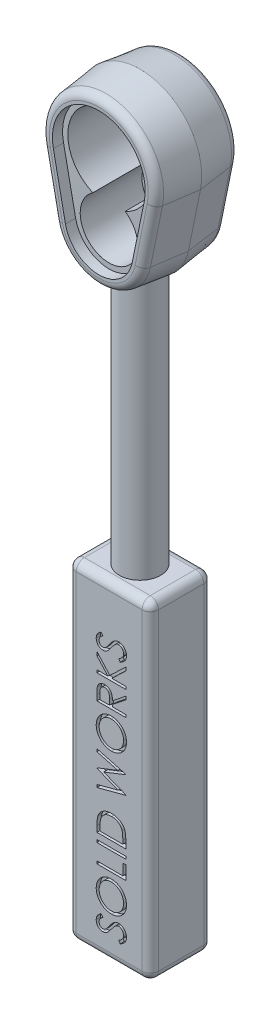
from build123d import *

# Parameters (mm, degrees)
BOSS_EXTRUDE1_DEPTH           = 0.5
BOSS_EXTRUDE1_TAPER           = 7
BOSS_EXTRUDE1_OTHER_WAY_DEPTH = 0.5
BOSS_EXTRUDE1_OTHER_WAY_TAPER = 7
CUT_EXTRUDE1_DEPTH            = 0.1235
CUT_EXTRUDE2_DEPTH            = 0.75
SKETCH6_R                     = 0.175
CUT_EXTRUDE3_DEPTH            = 2.890899971
FILLET3_R                     = 0.1
FILLET4_R                     = 0.1
BOSS_EXTRUDE2_REACH           = 7.573
SKETCH7_R                     = 0.25
SKETCH8_W                     = 1
SKETCH8_H                     = 4
BOSS_EXTRUDE3_DEPTH           = 0.375
FILLET5_R                     = 0.1
FILLET6_R                     = 0.1
SKETCH9_W                     = 0.35
SKETCH9_H                     = 0.031410256
CUT_EXTRUDE6_DEPTH            = 0.05


with BuildPart() as part:
    # Sketch2 → Boss-Extrude1 (new body)
    with BuildSketch(Plane.XY):
        with BuildLine():
            Line((-0.734846923, 0.6), (-0.587877538, -0.12))
            ThreePointArc((-0.587877538, -0.12), (0, -0.6), (0.587877538, -0.12))
            Line((0.587877538, -0.12), (0.734846923, 0.6))
            ThreePointArc((0.734846923, 0.6), (0, 1.5), (-0.734846923, 0.6))
        make_face()
    extrude(amount=BOSS_EXTRUDE1_DEPTH, taper=BOSS_EXTRUDE1_TAPER)

    # Sketch2 → Boss-Extrude1 other way (add)
    with BuildSketch(Plane.XY):
        with BuildLine():
            Line((-0.734846923, 0.6), (-0.587877538, -0.12))
            ThreePointArc((-0.587877538, -0.12), (0, -0.6), (0.587877538, -0.12))
            Line((0.587877538, -0.12), (0.734846923, 0.6))
            ThreePointArc((0.734846923, 0.6), (0, 1.5), (-0.734846923, 0.6))
        make_face()
    extrude(amount=-BOSS_EXTRUDE1_OTHER_WAY_DEPTH, taper=BOSS_EXTRUDE1_OTHER_WAY_TAPER)

    # Sketch4 → Cut-Extrude1 (cut)
    with BuildSketch(Plane.XY.offset(0.5)):
        with BuildLine():
            Line((-0.552220531, 0.637278456), (-0.405251147, -0.082721544))
            ThreePointArc((-0.405251147, -0.082721544), (0, -0.41360772), (0.405251147, -0.082721544))
            Line((0.405251147, -0.082721544), (0.552220531, 0.637278456))
            ThreePointArc((0.552220531, 0.637278456), (0, 1.31360772), (-0.552220531, 0.637278456))
        make_face()
    extrude(amount=-CUT_EXTRUDE1_DEPTH, mode=Mode.SUBTRACT)

    # Sketch5 → Cut-Extrude2 (cut)
    with BuildSketch(Plane.XY.offset(0.3765)):
        with BuildLine():
            ThreePointArc((-0.195959179, 0.29), (0, -0.35), (0.195959179, 0.29))
            ThreePointArc((0.195959179, 0.29), (0, 1.25), (-0.195959179, 0.29))
        make_face()
    extrude(amount=-CUT_EXTRUDE2_DEPTH, mode=Mode.SUBTRACT)

    # Sketch6 → Cut-Extrude3 (cut, through all)
    with BuildSketch(Plane.XY.offset(-0.3735)):
        Circle(SKETCH6_R)
        with Locations((0, 0.75)):
            Circle(SKETCH6_R)
    extrude(amount=-CUT_EXTRUDE3_DEPTH, mode=Mode.SUBTRACT)

    # Fillet3
    fillet3_edges = [part.edges().sort_by_distance(p)[0] for p in [
        (0, 1.43860772, 0.5),
        (-0.601210326, 0.252278456, 0.5),
        (0, -0.53860772, 0.5),
        (0.601210326, 0.252278456, 0.5),
    ]]
    fillet(fillet3_edges, radius=FILLET3_R)

    # Fillet4
    fillet4_edges = [part.edges().sort_by_distance(p)[0] for p in [
        (0, -0.53860772, -0.5),
        (0.601210326, 0.252278456, -0.5),
        (0, 1.43860772, -0.5),
        (-0.601210326, 0.252278456, -0.5),
    ]]
    fillet(fillet4_edges, radius=FILLET4_R)

    # Sketch7 → Boss-Extrude2 (add, up to next)
    with BuildSketch(Plane(origin=(0, -4, 0), x_dir=(1, 0, 0), z_dir=(0, 1, 0)), mode=Mode.PRIVATE) as boss_extrude2_sk1:
        with Locations(Location((0, 0, 0), (0, 0, 179.999989414))):
            Circle(SKETCH7_R)
    boss_extrude2_tool1 = extrude(boss_extrude2_sk1.sketch, amount=BOSS_EXTRUDE2_REACH, mode=Mode.PRIVATE) - part.part
    add(boss_extrude2_tool1.solids().sort_by_distance((0, -4, 0))[0])

    # Sketch8 → Boss-Extrude3 (add, symmetric)
    with BuildSketch(Plane.XY):
        with Locations((0, -5.7)):
            Rectangle(SKETCH8_W, SKETCH8_H)
    extrude(amount=BOSS_EXTRUDE3_DEPTH, both=True)

    # Fillet5
    fillet5_edges = [part.edges().sort_by_distance(p)[0] for p in [
        (-0.5, -5.7, -0.375),
        (0.5, -5.7, -0.375),
        (0.5, -7.7, 0),
        (0.5, -3.7, 0),
        (-0.5, -5.7, 0.375),
        (0.5, -5.7, 0.375),
    ]]
    fillet(fillet5_edges, radius=FILLET5_R)

    # Fillet6
    # the kernel refuses this fillet: 0.1 mm, written as the material it takes off along each edge
    with BuildSketch(Plane(origin=(0.4, -3.8, 0.275), x_dir=(0, 0, 1), z_dir=(0, 1, 0))) as fillet6_piece_1_section:
        Polygon((0, 0), (FILLET6_R, 0), (FILLET6_R, FILLET6_R), (0, FILLET6_R), align=None)
    fillet6_piece_1 = extrude(amount=FILLET6_R, mode=Mode.PRIVATE)
    fillet6_piece_1 = fillet6_piece_1 - Plane(origin=(0.4, -3.8, 0.275), x_dir=(-0.7071067811865475, 0, -0.7071067811865475), z_dir=(0, 1, 0)) * Sphere(FILLET6_R, mode=Mode.PRIVATE)
    add(fillet6_piece_1, mode=Mode.SUBTRACT)
    with BuildSketch(Plane(origin=(0.4, -3.8, -0.275), x_dir=(0, 0, -1), z_dir=(0, 1, 0))) as fillet6_piece_2_section:
        Polygon((0, 0), (FILLET6_R, 0), (FILLET6_R, -FILLET6_R), (0, -FILLET6_R), align=None)
    fillet6_piece_2 = extrude(amount=FILLET6_R, mode=Mode.PRIVATE)
    fillet6_piece_2 = fillet6_piece_2 - Plane(origin=(0.4, -3.8, -0.275), x_dir=(-0.7071067811865475, 0, 0.7071067811865475), z_dir=(0, 1, 0)) * Sphere(FILLET6_R, mode=Mode.PRIVATE)
    add(fillet6_piece_2, mode=Mode.SUBTRACT)
    with BuildSketch(Plane(origin=(0.4, -7.6, 0.275), x_dir=(0, -1, 0), z_dir=(0, 0, 1))) as fillet6_piece_3_section:
        Polygon((0, 0), (FILLET6_R, 0), (FILLET6_R, FILLET6_R), (0, FILLET6_R), align=None)
    fillet6_piece_3 = extrude(amount=FILLET6_R, mode=Mode.PRIVATE)
    fillet6_piece_3 = fillet6_piece_3 - Plane(origin=(0.4, -7.6, 0.275), x_dir=(-0.7071067811865476, 0.7071067811865475, 0), z_dir=(0, 0, 1)) * Sphere(FILLET6_R, mode=Mode.PRIVATE)
    add(fillet6_piece_3, mode=Mode.SUBTRACT)
    with BuildSketch(Plane(origin=(0.4, -7.6, -0.275), x_dir=(0, -1, 0), z_dir=(0, 0, -1))) as fillet6_piece_4_section:
        Polygon((0, 0), (FILLET6_R, 0), (FILLET6_R, -FILLET6_R), (0, -FILLET6_R), align=None)
    fillet6_piece_4 = extrude(amount=FILLET6_R, mode=Mode.PRIVATE)
    fillet6_piece_4 = fillet6_piece_4 - Plane(origin=(0.4, -7.6, -0.275), x_dir=(-0.7071067811865476, 0.7071067811865475, 0), z_dir=(0, 0, -1)) * Sphere(FILLET6_R, mode=Mode.PRIVATE)
    add(fillet6_piece_4, mode=Mode.SUBTRACT)
    with BuildSketch(Plane(origin=(0.4, -7.7, -0.375), x_dir=(0, 1, 0), z_dir=(-1, 0, 0)), Plane(origin=(-0.4, -3.7, 0.375), x_dir=(0, 0, -1), z_dir=(1, 0, 0))) as fillet6_piece_5:
        with BuildLine():
            CenterArc((FILLET6_R, -FILLET6_R), FILLET6_R, 90, 90)
            Line((0, -FILLET6_R), (0, 0))
            Line((0, 0), (FILLET6_R, 0))
        make_face()
    extrude(amount=0.8, mode=Mode.SUBTRACT)
    with BuildSketch(Plane(origin=(0.4, -7.7, 0.375), x_dir=(0, 1, 0), z_dir=(-1, 0, 0)), Plane(origin=(-0.4, -3.7, -0.375), x_dir=(0, 0, 1), z_dir=(1, 0, 0))) as fillet6_piece_6:
        with BuildLine():
            CenterArc((FILLET6_R, FILLET6_R), FILLET6_R, 180, 90)
            Line((0, FILLET6_R), (0, 0))
            Line((0, 0), (FILLET6_R, 0))
        make_face()
    extrude(amount=0.8, mode=Mode.SUBTRACT)
    with BuildSketch(Plane(origin=(-0.5, -7.7, -0.275), x_dir=(0, 1, 0), z_dir=(0, 0, 1)), Plane(origin=(-0.5, -3.7, -0.275), x_dir=(1, 0, 0), z_dir=(0, 0, 1))) as fillet6_piece_7:
        with BuildLine():
            CenterArc((FILLET6_R, -FILLET6_R), FILLET6_R, 90, 90)
            Line((0, -FILLET6_R), (0, 0))
            Line((0, 0), (FILLET6_R, 0))
        make_face()
    extrude(amount=0.55, mode=Mode.SUBTRACT)
    with BuildSketch(Plane(origin=(-0.4, -7.7, -0.275), x_dir=(-1, 0, 0), z_dir=(0, 0, 1))) as fillet6_piece_8:
        with BuildLine():
            CenterArc((0.1 - FILLET6_R, -FILLET6_R), FILLET6_R, 0, 90)
            Line((0.1 - FILLET6_R, 0), (0.1, 0))
            Line((0.1, 0), (0.1, -FILLET6_R))
        make_face()
    revolve(axis=Axis((-0.4, -7.7, -0.275), (0, -1, 0)), revolution_arc=90, mode=Mode.SUBTRACT)
    with BuildSketch(Plane(origin=(-0.4, -7.7, 0.275), x_dir=(-1, 0, 0), z_dir=(0, 0, -1))) as fillet6_piece_9:
        with BuildLine():
            CenterArc((0.1 - FILLET6_R, FILLET6_R), FILLET6_R, 270, 90)
            Line((0.1 - FILLET6_R, 0), (0.1, 0))
            Line((0.1, 0), (0.1, FILLET6_R))
        make_face()
    revolve(axis=Axis((-0.4, -7.7, 0.275), (0, 1, 0)), revolution_arc=90, mode=Mode.SUBTRACT)
    with BuildSketch(Plane(origin=(-0.4, -3.7, -0.275), x_dir=(-1, 0, 0), z_dir=(0, 0, 1))) as fillet6_piece_10:
        with BuildLine():
            CenterArc((0.1 - FILLET6_R, FILLET6_R), FILLET6_R, 270, 90)
            Line((0.1, FILLET6_R), (0.1, 0))
            Line((0.1, 0), (0.1 - FILLET6_R, 0))
        make_face()
    revolve(axis=Axis((-0.4, -3.7, -0.275), (0, -1, 0)), revolution_arc=90, mode=Mode.SUBTRACT)
    with BuildSketch(Plane(origin=(-0.4, -3.7, 0.275), x_dir=(-1, 0, 0), z_dir=(0, 0, -1))) as fillet6_piece_11:
        with BuildLine():
            CenterArc((0.1 - FILLET6_R, -FILLET6_R), FILLET6_R, 0, 90)
            Line((0.1, -FILLET6_R), (0.1, 0))
            Line((0.1, 0), (0.1 - FILLET6_R, 0))
        make_face()
    revolve(axis=Axis((-0.4, -3.7, 0.275), (0, 1, 0)), revolution_arc=90, mode=Mode.SUBTRACT)

    # Sketch9 → Cut-Extrude6 (cut)
    # profile 1 of 10: a face of its own
    with BuildSketch(Plane.XY.offset(0.375)):
        with BuildLine():
            Line((0.134581177, -7.445669674), (0.116842796, -7.416082334))
            add(Edge.make_bspline(
                [(0.116842796, -7.416082334), (0.121449234, -7.41333051), (0.130274992, -7.408058122), (0.142200797, -7.399262986), (0.152337012, -7.390149695), (0.160624673, -7.380650762), (0.167149562, -7.370824167), (0.171769785, -7.360605762), (0.174651382, -7.350029981), (0.175001391, -7.342832599), (0.175176129, -7.339239385)],
                knots=[0, 0, 0, 0, 1.272034388, 2.437168799, 3.508375237, 4.49857839, 5.41946034, 6.295179144, 7.148887113, 8, 8, 8, 8], degree=3))
            add(Edge.make_bspline(
                [(0.175176129, -7.339239385), (0.175088628, -7.336171321), (0.174915158, -7.330088875), (0.173315678, -7.321116985), (0.170698932, -7.312447084), (0.167151649, -7.304165356), (0.162791268, -7.296491213), (0.157649559, -7.289653822), (0.151708499, -7.283880371), (0.145188176, -7.27909411), (0.138196203, -7.275390536), (0.130991967, -7.272591339), (0.123476622, -7.271023638), (0.118415373, -7.270788391), (0.115861225, -7.270669674)],
                knots=[0, 0, 0, 0, 1.09553864, 2.171907928, 3.244545276, 4.325730702, 5.384330216, 6.391480148, 7.371786628, 8.333890167, 9.27165687, 10.191402356, 11.087295184, 12, 12, 12, 12], degree=3))
            add(Edge.make_bspline(
                [(0.115861225, -7.270669674), (0.112946167, -7.270813938), (0.107042858, -7.27110609), (0.098318316, -7.27368084), (0.08964709, -7.277612376), (0.084282368, -7.281307579), (0.081506257, -7.283219754)],
                knots=[0, 0, 0, 0, 0.938992559, 1.901562324, 2.914110574, 4, 4, 4, 4], degree=3))
            add(Edge.make_bspline(
                [(0.081506257, -7.283219754), (0.079501321, -7.284786586), (0.075292209, -7.288075953), (0.069032136, -7.293735738), (0.062561792, -7.300343298), (0.055739129, -7.3078082), (0.048620816, -7.316142964), (0.041151306, -7.325350815), (0.033483239, -7.335510337), (0.028347117, -7.342641271), (0.025696962, -7.346320716)],
                knots=[0, 0, 0, 0, 0.72225051, 1.516274602, 2.393638633, 3.3469932, 4.386926276, 5.505032946, 6.712638081, 8, 8, 8, 8], degree=3))
            add(Edge.make_bspline(
                [(0.025696962, -7.346320716), (0.023074103, -7.350003115), (0.018059397, -7.357043583), (0.010616969, -7.366889441), (0.003812582, -7.375693887), (-0.002417819, -7.383417789), (-0.00807508, -7.390057749), (-0.013104874, -7.39566609), (-0.01764323, -7.400099945), (-0.020587364, -7.402565504), (-0.021909208, -7.403672478)],
                knots=[0, 0, 0, 0, 1.452282411, 2.77665338, 3.964542531, 5.026858415, 5.96415736, 6.766646006, 7.446254459, 8, 8, 8, 8], degree=3))
            add(Edge.make_bspline(
                [(-0.021909208, -7.403672478), (-0.023969414, -7.405219474), (-0.028021085, -7.408261847), (-0.034352114, -7.412282143), (-0.040820622, -7.41567247), (-0.047450054, -7.418401049), (-0.054190585, -7.420607547), (-0.061092821, -7.42214163), (-0.068109905, -7.423087206), (-0.072831092, -7.423184881), (-0.075194464, -7.423233776)],
                knots=[0, 0, 0, 0, 1.068019517, 2.100403715, 3.106014851, 4.09224787, 5.069873182, 6.043214339, 7.020455327, 8, 8, 8, 8], degree=3))
            add(Edge.make_bspline(
                [(-0.075194464, -7.423233776), (-0.078897449, -7.423103261), (-0.086224269, -7.422845021), (-0.096927247, -7.420660885), (-0.107146281, -7.41721391), (-0.116777844, -7.412383241), (-0.125579941, -7.406161919), (-0.1336318, -7.398930996), (-0.140493155, -7.390398311), (-0.146394642, -7.380951994), (-0.151061564, -7.370666584), (-0.1544437, -7.359838284), (-0.156452645, -7.348544931), (-0.156732933, -7.340883333), (-0.156875153, -7.336995796)],
                knots=[0, 0, 0, 0, 1.005248779, 1.989011071, 2.95484373, 3.928844559, 4.904706341, 5.875556129, 6.859318422, 7.868909462, 8.894684146, 9.918924798, 10.944050749, 12, 12, 12, 12], degree=3))
            add(Edge.make_bspline(
                [(-0.156875153, -7.336995796), (-0.15673483, -7.332870718), (-0.156455771, -7.324667255), (-0.153969043, -7.312619683), (-0.150011302, -7.300972921), (-0.145367836, -7.291645397), (-0.140759643, -7.284329757), (-0.136553182, -7.278756248), (-0.131720553, -7.273077629), (-0.126159876, -7.26735493), (-0.119982371, -7.261531655), (-0.113135745, -7.255634628), (-0.105681697, -7.249608663), (-0.100359019, -7.245733295), (-0.097630361, -7.243746597)],
                knots=[0, 0, 0, 0, 1.286507425, 2.558452658, 3.822738219, 5.118007103, 5.800084425, 6.519418873, 7.295692132, 8.12638276, 9.008892966, 9.945018126, 10.946518512, 12, 12, 12, 12], degree=3))
            Line((-0.097630361, -7.243746597), (-0.076105922, -7.27214203))
            add(Edge.make_bspline(
                [(-0.076105922, -7.27214203), (-0.078314919, -7.273856498), (-0.082568931, -7.277158163), (-0.088524362, -7.282172774), (-0.093971772, -7.286892004), (-0.098690828, -7.291577168), (-0.103034911, -7.295867133), (-0.106688145, -7.300104751), (-0.109765953, -7.30412649), (-0.113056539, -7.309183717), (-0.116219721, -7.315590064), (-0.118998205, -7.323564935), (-0.120646549, -7.331927168), (-0.120866413, -7.33761964), (-0.120977717, -7.340501405)],
                knots=[0, 0, 0, 0, 1.181392137, 2.275085037, 3.289537922, 4.225335853, 5.084247276, 5.86831218, 6.587234301, 7.222706459, 8.415108401, 9.595592188, 10.782789524, 12, 12, 12, 12], degree=3))
            add(Edge.make_bspline(
                [(-0.120977717, -7.340501405), (-0.120858531, -7.34411791), (-0.120628693, -7.351092), (-0.118052455, -7.360970099), (-0.11413546, -7.369912244), (-0.108487193, -7.37757707), (-0.101753372, -7.383905797), (-0.094073923, -7.388540567), (-0.08559227, -7.391311614), (-0.079678571, -7.391650785), (-0.07666682, -7.39182352)],
                knots=[0, 0, 0, 0, 1.144248881, 2.206576175, 3.214949548, 4.222996039, 5.203671638, 6.127710127, 7.046472867, 8, 8, 8, 8], degree=3))
            add(Edge.make_bspline(
                [(-0.07666682, -7.39182352), (-0.074792102, -7.391781962), (-0.071016551, -7.391698266), (-0.06546504, -7.390628767), (-0.0599428, -7.389182718), (-0.054469267, -7.386965855), (-0.048920497, -7.383878689), (-0.043218117, -7.379828989), (-0.03731301, -7.374727405), (-0.033472263, -7.370819741), (-0.031444464, -7.368756613)],
                knots=[0, 0, 0, 0, 0.858259122, 1.72847414, 2.583651051, 3.473048463, 4.427392529, 5.488649985, 6.674082839, 8, 8, 8, 8], degree=3))
            add(Edge.make_bspline(
                [(-0.031444464, -7.368756613), (-0.030760761, -7.367990476), (-0.029136441, -7.366170309), (-0.026477213, -7.362842716), (-0.023196935, -7.358448437), (-0.019138204, -7.353102216), (-0.014430057, -7.34670548), (-0.009132696, -7.339257525), (-0.00307415, -7.330841371), (0.001161604, -7.32486918), (0.003401289, -7.321711341)],
                knots=[0, 0, 0, 0, 0.420754252, 0.999615792, 1.744751191, 2.668019286, 3.750313428, 4.999500688, 6.413464383, 8, 8, 8, 8], degree=3))
            add(Edge.make_bspline(
                [(0.003401289, -7.321711341), (0.006165427, -7.317912752), (0.011517797, -7.310557311), (0.019559339, -7.300091517), (0.027424206, -7.290602261), (0.035061663, -7.282055523), (0.042415484, -7.274369221), (0.049568441, -7.267620836), (0.056473626, -7.26177975), (0.065266301, -7.255405525), (0.076165145, -7.248969447), (0.089524302, -7.243451039), (0.102921796, -7.239940323), (0.111914886, -7.239484377), (0.11635201, -7.239259417)],
                knots=[0, 0, 0, 0, 1.163604038, 2.253157948, 3.268574773, 4.215621239, 5.091738613, 5.902582348, 6.650434646, 7.330118262, 8.591011492, 9.77460283, 10.902005569, 12, 12, 12, 12], degree=3))
            add(Edge.make_bspline(
                [(0.11635201, -7.239259417), (0.119489814, -7.239325198), (0.125704486, -7.239455482), (0.134830477, -7.2409506), (0.143691766, -7.243146189), (0.152170058, -7.246428776), (0.160401387, -7.250500629), (0.168230692, -7.255593345), (0.17581008, -7.261527322), (0.182927061, -7.26833081), (0.189468484, -7.275771577), (0.195263334, -7.283664262), (0.200206388, -7.291926472), (0.204143046, -7.300647683), (0.207242695, -7.309734203), (0.209482256, -7.319215999), (0.210858296, -7.329102674), (0.211001007, -7.33582276), (0.211073565, -7.339239385)],
                knots=[0, 0, 0, 0, 0.983922938, 1.948738757, 2.895227473, 3.844781104, 4.796118043, 5.772795661, 6.770647148, 7.813532943, 8.8582745, 9.876489951, 10.882905461, 11.874265028, 12.874055871, 13.891769171, 14.928133632, 16, 16, 16, 16], degree=3))
            add(Edge.make_bspline(
                [(0.211073565, -7.339239385), (0.211022447, -7.34188292), (0.210920854, -7.347136696), (0.210022726, -7.354907644), (0.208752015, -7.362521602), (0.20673461, -7.369883032), (0.204286907, -7.377086768), (0.201273091, -7.384101511), (0.197661306, -7.390930541), (0.193532052, -7.397612591), (0.188725311, -7.404128875), (0.183131816, -7.41042534), (0.176894199, -7.416667628), (0.169916101, -7.422811459), (0.162120785, -7.428722794), (0.153624368, -7.434543545), (0.144401581, -7.440245345), (0.137915786, -7.443827792), (0.134581177, -7.445669674)],
                knots=[0, 0, 0, 0, 0.915313873, 1.819100311, 2.706792138, 3.586475221, 4.459428225, 5.3405999, 6.2277379, 7.133009489, 8.059106158, 9.028520402, 10.047404263, 11.114294124, 12.246039232, 13.433834781, 14.680630578, 16, 16, 16, 16], degree=3))
        make_face()
    # profile 2 of 10: a face of its own
    with BuildSketch(Plane.XY.offset(0.375)):
        with BuildLine():
            add(Edge.make_bspline(
                [(-0.156875153, -7.003682494), (-0.156713769, -6.997200977), (-0.156396796, -6.984470743), (-0.153890317, -6.96577859), (-0.149764916, -6.947880017), (-0.143938968, -6.930764731), (-0.136386358, -6.914497828), (-0.127212101, -6.899033366), (-0.116360441, -6.884417689), (-0.103990726, -6.870751403), (-0.09044387, -6.858284585), (-0.075941703, -6.847344887), (-0.060666556, -6.838116219), (-0.044617633, -6.83056155), (-0.027832403, -6.824630633), (-0.010216794, -6.820539017), (0.008113818, -6.817925123), (0.020616513, -6.817619556), (0.026958981, -6.817464546)],
                knots=[0, 0, 0, 0, 1.065064174, 2.09187391, 3.093564831, 4.079973196, 5.057907931, 6.036227367, 7.030399151, 8.044883615, 9.061699972, 10.052012555, 11.025713132, 11.989727027, 12.962874294, 13.945865945, 14.957962116, 16, 16, 16, 16], degree=3))
            add(Edge.make_bspline(
                [(0.026958981, -6.817464546), (0.033254693, -6.817619608), (0.045664271, -6.817925255), (0.063879084, -6.820541138), (0.081386435, -6.82464889), (0.098147305, -6.830488117), (0.114163632, -6.838048584), (0.129450343, -6.847290837), (0.143991245, -6.858209773), (0.157631428, -6.870623651), (0.170109038, -6.884196314), (0.181114776, -6.898642745), (0.190347461, -6.913917485), (0.197986472, -6.929862241), (0.203793788, -6.946602218), (0.208021707, -6.964015598), (0.210609652, -6.982197255), (0.21091723, -6.99458276), (0.211073565, -7.000878007)],
                knots=[0, 0, 0, 0, 1.043748596, 2.057349401, 3.045489418, 4.02252776, 4.995289225, 5.97782527, 6.980224157, 8.006516136, 9.032559198, 10.034193337, 11.013412982, 11.987833483, 12.961212594, 13.946489799, 14.956251404, 16, 16, 16, 16], degree=3))
            add(Edge.make_bspline(
                [(0.211073565, -7.000878007), (0.210918626, -7.007220439), (0.210613201, -7.019723061), (0.20799506, -7.038076764), (0.20390093, -7.055704539), (0.198049986, -7.072555974), (0.190488263, -7.088640467), (0.181267825, -7.103989475), (0.170327111, -7.11854139), (0.157910454, -7.132175564), (0.144393299, -7.144650484), (0.129909873, -7.155526422), (0.114744327, -7.164748933), (0.098854575, -7.172285266), (0.082317431, -7.178251712), (0.065022583, -7.182322194), (0.047068632, -7.184955789), (0.034844342, -7.185259274), (0.028641674, -7.185413264)],
                knots=[0, 0, 0, 0, 1.053102029, 2.075944431, 3.073151272, 4.055350789, 5.033113405, 6.020478099, 7.024410459, 8.052272461, 9.079885166, 10.07527673, 11.055994387, 12.023226415, 12.992069828, 13.970394897, 14.97016774, 16, 16, 16, 16], degree=3))
            add(Edge.make_bspline(
                [(0.028641674, -7.185413264), (0.024478407, -7.1853598), (0.016204395, -7.185253547), (0.003917735, -7.183974378), (-0.008171331, -7.182118208), (-0.020028426, -7.179458017), (-0.031624525, -7.17597885), (-0.043039601, -7.171873647), (-0.054157973, -7.166859663), (-0.065032312, -7.161191598), (-0.075493103, -7.154865417), (-0.085381061, -7.147877842), (-0.094779161, -7.140474305), (-0.103443861, -7.132357966), (-0.111627227, -7.123796322), (-0.119203499, -7.114650484), (-0.126240994, -7.104976259), (-0.132583028, -7.094732021), (-0.138318941, -7.084170194), (-0.143241126, -7.073282516), (-0.147465733, -7.062216859), (-0.150889815, -7.050921394), (-0.153593019, -7.039426117), (-0.155433754, -7.027705938), (-0.156716186, -7.015770196), (-0.156821936, -7.007729064), (-0.156875153, -7.003682494)],
                knots=[0, 0, 0, 0, 1.037015668, 2.060948919, 3.074880161, 4.083647147, 5.086022904, 6.090072063, 7.104153813, 8.122640571, 9.144368836, 10.147691507, 11.138137339, 12.123020368, 13.103399296, 14.087645067, 15.080126199, 16.082011238, 17.087798457, 18.072939717, 19.057185487, 20.037253025, 21.01195951, 21.997135196, 22.992090687, 24, 24, 24, 24], degree=3))
        make_face()
        with BuildLine():
            add(Edge.make_bspline(
                [(-0.120977717, -7.002140026), (-0.120937369, -7.005461532), (-0.12085706, -7.01207279), (-0.1197934, -7.021900616), (-0.118288272, -7.031602174), (-0.116102299, -7.04115869), (-0.113274838, -7.050590207), (-0.109864697, -7.059900911), (-0.105743029, -7.06905888), (-0.101107714, -7.078052672), (-0.095842737, -7.08667456), (-0.090251846, -7.094945309), (-0.084127309, -7.102649788), (-0.077601578, -7.109893837), (-0.07061802, -7.116659439), (-0.063222496, -7.122943611), (-0.05538302, -7.128741199), (-0.047131854, -7.133982432), (-0.038515066, -7.13864672), (-0.029697372, -7.142822852), (-0.020575145, -7.146284707), (-0.011205312, -7.149027012), (-0.001629162, -7.1513546), (0.008205478, -7.152814636), (0.018264705, -7.153888775), (0.025062929, -7.153964637), (0.028501449, -7.154003007)],
                knots=[0, 0, 0, 0, 1.008406545, 2.007172654, 2.999155034, 3.989332444, 4.982025741, 5.988181096, 6.998684226, 8.030553839, 9.059268815, 10.065399129, 11.060956322, 12.046057109, 13.024974577, 14.012068307, 14.991706172, 15.984221787, 16.978487447, 17.966117052, 18.945677757, 19.938371053, 20.93015022, 21.936155317, 22.956113857, 24, 24, 24, 24], degree=3))
            add(Edge.make_bspline(
                [(0.028501449, -7.154003007), (0.033557557, -7.153875229), (0.043504483, -7.153623851), (0.058082938, -7.151432255), (0.07210709, -7.148029587), (0.085493351, -7.143096361), (0.098301414, -7.136803057), (0.110481433, -7.129126504), (0.122029817, -7.119996401), (0.132860599, -7.109631506), (0.142742346, -7.098297766), (0.151428455, -7.086268771), (0.158738926, -7.073639689), (0.164850315, -7.06048331), (0.169454382, -7.04668731), (0.172737079, -7.032340141), (0.174864689, -7.017441486), (0.17507133, -7.007288917), (0.175176129, -7.002140026)],
                knots=[0, 0, 0, 0, 1.032022337, 2.030307203, 3.003823408, 3.974715386, 4.937372378, 5.913284036, 6.909147208, 7.938749767, 8.970518239, 9.975863271, 10.963918693, 11.946286286, 12.933361397, 13.927862637, 14.949112547, 16, 16, 16, 16], degree=3))
            add(Edge.make_bspline(
                [(0.175176129, -7.002140026), (0.175128617, -6.998679063), (0.175034386, -6.991814932), (0.174083956, -6.981605579), (0.172562879, -6.971579209), (0.170362024, -6.961754347), (0.167643989, -6.952118119), (0.164272547, -6.942699603), (0.160230997, -6.933501926), (0.155726823, -6.924479861), (0.150610202, -6.915835421), (0.145094681, -6.907614841), (0.139078209, -6.899923635), (0.132640121, -6.892682986), (0.125678031, -6.885964799), (0.118327453, -6.879698519), (0.110471338, -6.874001173), (0.102253967, -6.868777708), (0.0937, -6.864056509), (0.084858064, -6.860001172), (0.075775581, -6.85653783), (0.066445878, -6.853745985), (0.056889941, -6.851557167), (0.047094093, -6.850049249), (0.037078169, -6.848994385), (0.030303782, -6.84891488), (0.026888869, -6.848874802)],
                knots=[0, 0, 0, 0, 1.047334373, 2.07717862, 3.100662057, 4.115010574, 5.122652213, 6.129548646, 7.140165612, 8.16200981, 9.179904151, 10.178566626, 11.156366481, 12.133321541, 13.108841334, 14.082538371, 15.054589433, 16.043660176, 17.028268541, 18.009491307, 18.985652105, 19.968123554, 20.954864208, 21.950389976, 22.966808393, 24, 24, 24, 24], degree=3))
            add(Edge.make_bspline(
                [(0.026888869, -6.848874802), (0.023497319, -6.848914913), (0.016769554, -6.848994481), (0.006823472, -6.850048729), (-0.002901849, -6.851558818), (-0.012368229, -6.853735089), (-0.021578082, -6.856540104), (-0.030522756, -6.859998838), (-0.039235578, -6.864077366), (-0.047695, -6.868758194), (-0.055812503, -6.874019756), (-0.063572635, -6.879769255), (-0.070830316, -6.886105512), (-0.077762264, -6.892849152), (-0.084229827, -6.900162305), (-0.090208013, -6.908046248), (-0.095966182, -6.916304681), (-0.101062225, -6.925124362), (-0.105791974, -6.934193939), (-0.109827176, -6.943508903), (-0.113292844, -6.952936223), (-0.11611074, -6.962513592), (-0.118279899, -6.972236481), (-0.119794747, -6.982099238), (-0.120856694, -6.992067435), (-0.120937248, -6.998771841), (-0.120977717, -7.002140026)],
                knots=[0, 0, 0, 0, 1.029877221, 2.042951179, 3.035109885, 4.018542222, 4.991021277, 5.957494829, 6.929429462, 7.911425532, 8.892163142, 9.866273635, 10.842761649, 11.81676864, 12.802607151, 13.805177466, 14.821356543, 15.858816981, 16.897175917, 17.927346774, 18.940346092, 19.946830556, 20.957962087, 21.964146003, 22.97721996, 24, 24, 24, 24], degree=3))
        make_face(mode=Mode.SUBTRACT)
    # profile 3 of 10: a face of its own
    with BuildSketch(Plane.XY.offset(0.375)):
        Polygon((-0.147900794, -6.745669674), (-0.147900794, -6.714259417), (0.16620177, -6.714259417), (0.16620177, -6.579644033), (0.202099206, -6.579644033), (0.202099206, -6.745669674), align=None)
    # profile 4 of 10: a face of its own
    with BuildSketch(Plane.XY.offset(0.375)):
        with Locations((0.027099206, -6.505605571)):
            Rectangle(SKETCH9_W, SKETCH9_H)
    # profile 5 of 10: a face of its own
    with BuildSketch(Plane.XY.offset(0.375)):
        with BuildLine():
            Line((0.202099206, -6.413618392), (-0.147900794, -6.413618392))
            Line((-0.147900794, -6.413618392), (-0.147900794, -6.342945315))
            add(Edge.make_bspline(
                [(-0.147900794, -6.342945315), (-0.147856537, -6.336798416), (-0.147771033, -6.32492264), (-0.147228894, -6.307761395), (-0.146269847, -6.291883019), (-0.144872895, -6.277339733), (-0.143157591, -6.264091611), (-0.141007551, -6.252175751), (-0.138468734, -6.241530536), (-0.136304189, -6.234983592), (-0.135280602, -6.231887623)],
                knots=[0, 0, 0, 0, 1.314313732, 2.53924729, 3.670748893, 4.714932338, 5.66265055, 6.526160246, 7.303039223, 8, 8, 8, 8], degree=3))
            add(Edge.make_bspline(
                [(-0.135280602, -6.231887623), (-0.133738012, -6.227837784), (-0.130687813, -6.219829944), (-0.124925206, -6.208434526), (-0.118422742, -6.197670456), (-0.111030778, -6.187623556), (-0.102845842, -6.178268617), (-0.093926408, -6.169499462), (-0.084074333, -6.161532296), (-0.073464979, -6.154243029), (-0.062234282, -6.147669035), (-0.050400634, -6.141955235), (-0.03802495, -6.137209804), (-0.025141425, -6.13327049), (-0.01172179, -6.130165842), (0.002249597, -6.12804765), (0.016717516, -6.12665055), (0.026534962, -6.126510145), (0.031516273, -6.126438905)],
                knots=[0, 0, 0, 0, 0.984741985, 1.947153288, 2.898543998, 3.841229145, 4.778974371, 5.722123648, 6.681464302, 7.655713756, 8.646344578, 9.637374342, 10.639946623, 11.656849581, 12.698333139, 13.76849723, 14.867749466, 16, 16, 16, 16], degree=3))
            add(Edge.make_bspline(
                [(0.031516273, -6.126438905), (0.035842397, -6.126501801), (0.044367476, -6.126625746), (0.056931566, -6.127738677), (0.069122921, -6.129356312), (0.080883498, -6.131860722), (0.092316293, -6.134901007), (0.103299617, -6.138797299), (0.113933633, -6.1432613), (0.124076724, -6.14846463), (0.133680179, -6.15418479), (0.142739936, -6.16028517), (0.151054956, -6.16690412), (0.158843131, -6.17384574), (0.165896408, -6.181277427), (0.172343358, -6.1891087), (0.178076047, -6.197369994), (0.183184557, -6.206112449), (0.187752957, -6.215452823), (0.19156355, -6.225684917), (0.194863913, -6.236760264), (0.197489352, -6.248742024), (0.199606787, -6.261587461), (0.201016584, -6.27533221), (0.201972692, -6.289950295), (0.202056216, -6.299988256), (0.202099206, -6.30515485)],
                knots=[0, 0, 0, 0, 1.106010661, 2.179509527, 3.223302912, 4.248870533, 5.252098245, 6.246278179, 7.226402005, 8.199283979, 9.158616973, 10.083547221, 10.989831858, 11.874256832, 12.749262829, 13.607058236, 14.46581075, 15.317568432, 16.194266721, 17.121067875, 18.106207572, 19.147242834, 20.255495536, 21.43354536, 22.679031616, 24, 24, 24, 24], degree=3))
            Line((0.202099206, -6.30515485), (0.202099206, -6.413618392))
        make_face()
        with BuildLine():
            Line((0.16620177, -6.382208135), (0.16620177, -6.342033857))
            add(Edge.make_bspline(
                [(0.16620177, -6.342033857), (0.16617696, -6.336261019), (0.166129242, -6.32515774), (0.165710522, -6.30919194), (0.165026328, -6.294604), (0.16406882, -6.281391849), (0.162801959, -6.269562947), (0.161389469, -6.259092572), (0.159629724, -6.250015046), (0.158034628, -6.244522102), (0.157297523, -6.241983776)],
                knots=[0, 0, 0, 0, 1.375205317, 2.645023457, 3.804390687, 4.853969522, 5.800190428, 6.637939096, 7.370582563, 8, 8, 8, 8], degree=3))
            add(Edge.make_bspline(
                [(0.157297523, -6.241983776), (0.156172368, -6.23878894), (0.153948931, -6.232475575), (0.149893161, -6.223387472), (0.145088966, -6.214911754), (0.139748697, -6.206900816), (0.13368425, -6.199467909), (0.127026578, -6.192526404), (0.119745263, -6.186084801), (0.111852114, -6.180242317), (0.103432721, -6.174950372), (0.094472195, -6.170407458), (0.085096506, -6.166451176), (0.075229753, -6.163318517), (0.064944255, -6.160848552), (0.054186676, -6.159117245), (0.042966536, -6.158042424), (0.035328156, -6.157914284), (0.031446161, -6.157849161)],
                knots=[0, 0, 0, 0, 0.998590647, 1.973329978, 2.929871262, 3.868367705, 4.809062953, 5.754642869, 6.701828697, 7.672172887, 8.647399344, 9.630604387, 10.631475358, 11.644913558, 12.679592956, 13.747988925, 14.855477812, 16, 16, 16, 16], degree=3))
            add(Edge.make_bspline(
                [(0.031446161, -6.157849161), (0.027352813, -6.15790049), (0.019311395, -6.158001326), (0.007512325, -6.159268757), (-0.00383574, -6.161120912), (-0.01473356, -6.163799281), (-0.025202395, -6.167212369), (-0.035184346, -6.171471833), (-0.044784833, -6.176338495), (-0.053782269, -6.182128828), (-0.06229158, -6.188470388), (-0.070087072, -6.195508176), (-0.077186502, -6.20313038), (-0.083700433, -6.211253864), (-0.089366801, -6.220107574), (-0.094435469, -6.229482943), (-0.098737058, -6.239517511), (-0.101024944, -6.24649878), (-0.102187653, -6.250046677)],
                knots=[0, 0, 0, 0, 1.122418816, 2.205001699, 3.251619955, 4.274784885, 5.280384055, 6.268708349, 7.249350384, 8.229342522, 9.199999885, 10.157847722, 11.105861043, 12.055065948, 13.010012805, 13.98527497, 14.976112212, 16, 16, 16, 16], degree=3))
            add(Edge.make_bspline(
                [(-0.102187653, -6.250046677), (-0.102999296, -6.252981792), (-0.104725071, -6.259222651), (-0.106607608, -6.269406597), (-0.108268058, -6.280868112), (-0.109673862, -6.293658082), (-0.110682594, -6.307761928), (-0.111439726, -6.323190497), (-0.111950389, -6.339950457), (-0.11198526, -6.351568711), (-0.112003358, -6.35759876)],
                knots=[0, 0, 0, 0, 0.674548936, 1.434276114, 2.292660221, 3.240891867, 4.284742987, 5.42552168, 6.663806718, 8, 8, 8, 8], degree=3))
            Line((-0.112003358, -6.35759876), (-0.112003358, -6.382208135))
            Line((-0.112003358, -6.382208135), (0.16620177, -6.382208135))
        make_face(mode=Mode.SUBTRACT)
    # profile 6 of 10: a face of its own
    with BuildSketch(Plane.XY.offset(0.375)):
        Polygon((-0.147900794, -5.942464546), (-0.147900794, -5.910002607), (0.108779895, -5.841503007), (-0.147900794, -5.73963001), (-0.147900794, -5.735072719), (0.10702709, -5.635092751), (-0.147900794, -5.566242591), (-0.147900794, -5.534131212), (0.202099206, -5.628502206), (0.202099206, -5.632989385), (-0.065589095, -5.738297879), (0.202099206, -5.844868392), (0.202099206, -5.849355571), align=None)
    # profile 7 of 10: a face of its own
    with BuildSketch(Plane.XY.offset(0.375)):
        with BuildLine():
            add(Edge.make_bspline(
                [(-0.156875153, -5.28957993), (-0.156713769, -5.283098413), (-0.156396796, -5.270368179), (-0.153890317, -5.251676026), (-0.149764916, -5.233777452), (-0.143938968, -5.216662167), (-0.136386358, -5.200395264), (-0.127212101, -5.184930802), (-0.116360441, -5.170315125), (-0.103990726, -5.156648839), (-0.09044387, -5.144182021), (-0.075941703, -5.133242323), (-0.060666556, -5.124013655), (-0.044617633, -5.116458985), (-0.027832403, -5.110528069), (-0.010216794, -5.106436453), (0.008113818, -5.103822559), (0.020616513, -5.103516992), (0.026958981, -5.103361982)],
                knots=[0, 0, 0, 0, 1.065064174, 2.09187391, 3.093564831, 4.079973196, 5.057907931, 6.036227367, 7.030399151, 8.044883615, 9.061699972, 10.052012555, 11.025713132, 11.989727027, 12.962874294, 13.945865945, 14.957962116, 16, 16, 16, 16], degree=3))
            add(Edge.make_bspline(
                [(0.026958981, -5.103361982), (0.033254693, -5.103517044), (0.045664271, -5.103822691), (0.063879084, -5.106438573), (0.081386435, -5.110546326), (0.098147305, -5.116385553), (0.114163632, -5.123946019), (0.129450343, -5.133188273), (0.143991245, -5.144107209), (0.157631428, -5.156521087), (0.170109038, -5.17009375), (0.181114776, -5.184540181), (0.190347461, -5.199814921), (0.197986472, -5.215759677), (0.203793788, -5.232499654), (0.208021707, -5.249913034), (0.210609652, -5.268094691), (0.21091723, -5.280480196), (0.211073565, -5.286775443)],
                knots=[0, 0, 0, 0, 1.043748596, 2.057349401, 3.045489418, 4.02252776, 4.995289225, 5.97782527, 6.980224157, 8.006516136, 9.032559198, 10.034193337, 11.013412982, 11.987833483, 12.961212594, 13.946489799, 14.956251404, 16, 16, 16, 16], degree=3))
            add(Edge.make_bspline(
                [(0.211073565, -5.286775443), (0.210918626, -5.293117875), (0.210613201, -5.305620497), (0.20799506, -5.3239742), (0.20390093, -5.341601974), (0.198049986, -5.35845341), (0.190488263, -5.374537903), (0.181267825, -5.389886911), (0.170327111, -5.404438826), (0.157910454, -5.418073), (0.144393299, -5.43054792), (0.129909873, -5.441423858), (0.114744327, -5.450646369), (0.098854575, -5.458182702), (0.082317431, -5.464149148), (0.065022583, -5.46821963), (0.047068632, -5.470853225), (0.034844342, -5.47115671), (0.028641674, -5.471310699)],
                knots=[0, 0, 0, 0, 1.053102029, 2.075944431, 3.073151272, 4.055350789, 5.033113405, 6.020478099, 7.024410459, 8.052272461, 9.079885166, 10.07527673, 11.055994387, 12.023226415, 12.992069828, 13.970394897, 14.97016774, 16, 16, 16, 16], degree=3))
            add(Edge.make_bspline(
                [(0.028641674, -5.471310699), (0.024478407, -5.471257236), (0.016204395, -5.471150983), (0.003917735, -5.469871814), (-0.008171331, -5.468015644), (-0.020028426, -5.465355453), (-0.031624525, -5.461876286), (-0.043039601, -5.457771083), (-0.054157973, -5.452757099), (-0.065032312, -5.447089034), (-0.075493103, -5.440762853), (-0.085381061, -5.433775278), (-0.094779161, -5.426371741), (-0.103443861, -5.418255402), (-0.111627227, -5.409693757), (-0.119203499, -5.40054792), (-0.126240994, -5.390873695), (-0.132583028, -5.380629457), (-0.138318941, -5.37006763), (-0.143241126, -5.359179952), (-0.147465733, -5.348114295), (-0.150889815, -5.33681883), (-0.153593019, -5.325323553), (-0.155433754, -5.313603374), (-0.156716186, -5.301667632), (-0.156821936, -5.2936265), (-0.156875153, -5.28957993)],
                knots=[0, 0, 0, 0, 1.037015668, 2.060948919, 3.074880161, 4.083647147, 5.086022904, 6.090072063, 7.104153813, 8.122640571, 9.144368836, 10.147691507, 11.138137339, 12.123020368, 13.103399296, 14.087645067, 15.080126199, 16.082011238, 17.087798457, 18.072939717, 19.057185487, 20.037253025, 21.01195951, 21.997135196, 22.992090687, 24, 24, 24, 24], degree=3))
        make_face()
        with BuildLine():
            add(Edge.make_bspline(
                [(-0.120977717, -5.288037462), (-0.120937369, -5.291358968), (-0.12085706, -5.297970226), (-0.1197934, -5.307798052), (-0.118288272, -5.31749961), (-0.116102299, -5.327056126), (-0.113274838, -5.336487643), (-0.109864697, -5.345798347), (-0.105743029, -5.354956316), (-0.101107714, -5.363950108), (-0.095842737, -5.372571996), (-0.090251846, -5.380842745), (-0.084127309, -5.388547224), (-0.077601578, -5.395791273), (-0.07061802, -5.402556875), (-0.063222496, -5.408841047), (-0.05538302, -5.414638635), (-0.047131854, -5.419879867), (-0.038515066, -5.424544156), (-0.029697372, -5.428720288), (-0.020575145, -5.432182143), (-0.011205312, -5.434924448), (-0.001629162, -5.437252036), (0.008205478, -5.438712072), (0.018264705, -5.439786211), (0.025062929, -5.439862073), (0.028501449, -5.439900443)],
                knots=[0, 0, 0, 0, 1.008406545, 2.007172654, 2.999155034, 3.989332444, 4.982025741, 5.988181096, 6.998684226, 8.030553839, 9.059268815, 10.065399129, 11.060956322, 12.046057109, 13.024974577, 14.012068307, 14.991706172, 15.984221787, 16.978487447, 17.966117052, 18.945677757, 19.938371053, 20.93015022, 21.936155317, 22.956113857, 24, 24, 24, 24], degree=3))
            add(Edge.make_bspline(
                [(0.028501449, -5.439900443), (0.033557557, -5.439772665), (0.043504483, -5.439521287), (0.058082938, -5.437329691), (0.07210709, -5.433927023), (0.085493351, -5.428993797), (0.098301414, -5.422700493), (0.110481433, -5.41502394), (0.122029817, -5.405893837), (0.132860599, -5.395528942), (0.142742346, -5.384195202), (0.151428455, -5.372166207), (0.158738926, -5.359537124), (0.164850315, -5.346380746), (0.169454382, -5.332584745), (0.172737079, -5.318237576), (0.174864689, -5.303338922), (0.17507133, -5.293186353), (0.175176129, -5.288037462)],
                knots=[0, 0, 0, 0, 1.032022337, 2.030307203, 3.003823408, 3.974715386, 4.937372378, 5.913284036, 6.909147208, 7.938749767, 8.970518239, 9.975863271, 10.963918693, 11.946286286, 12.933361397, 13.927862637, 14.949112547, 16, 16, 16, 16], degree=3))
            add(Edge.make_bspline(
                [(0.175176129, -5.288037462), (0.175128617, -5.284576499), (0.175034386, -5.277712368), (0.174083956, -5.267503015), (0.172562879, -5.257476645), (0.170362024, -5.247651783), (0.167643989, -5.238015555), (0.164272547, -5.228597039), (0.160230997, -5.219399362), (0.155726823, -5.210377297), (0.150610202, -5.201732857), (0.145094681, -5.193512277), (0.139078209, -5.185821071), (0.132640121, -5.178580422), (0.125678031, -5.171862235), (0.118327453, -5.165595955), (0.110471338, -5.159898609), (0.102253967, -5.154675144), (0.0937, -5.149953945), (0.084858064, -5.145898608), (0.075775581, -5.142435266), (0.066445878, -5.13964342), (0.056889941, -5.137454603), (0.047094093, -5.135946685), (0.037078169, -5.134891821), (0.030303782, -5.134812316), (0.026888869, -5.134772238)],
                knots=[0, 0, 0, 0, 1.047334373, 2.07717862, 3.100662057, 4.115010574, 5.122652213, 6.129548646, 7.140165612, 8.16200981, 9.179904151, 10.178566626, 11.156366481, 12.133321541, 13.108841334, 14.082538371, 15.054589433, 16.043660176, 17.028268541, 18.009491307, 18.985652105, 19.968123554, 20.954864208, 21.950389976, 22.966808393, 24, 24, 24, 24], degree=3))
            add(Edge.make_bspline(
                [(0.026888869, -5.134772238), (0.023497319, -5.134812349), (0.016769554, -5.134891917), (0.006823472, -5.135946165), (-0.002901849, -5.137456254), (-0.012368229, -5.139632525), (-0.021578082, -5.14243754), (-0.030522756, -5.145896273), (-0.039235578, -5.149974802), (-0.047695, -5.15465563), (-0.055812503, -5.159917192), (-0.063572635, -5.165666691), (-0.070830316, -5.172002948), (-0.077762264, -5.178746588), (-0.084229827, -5.186059741), (-0.090208013, -5.193943684), (-0.095966182, -5.202202117), (-0.101062225, -5.211021798), (-0.105791974, -5.220091375), (-0.109827176, -5.229406339), (-0.113292844, -5.238833659), (-0.11611074, -5.248411027), (-0.118279899, -5.258133917), (-0.119794747, -5.267996674), (-0.120856694, -5.27796487), (-0.120937248, -5.284669277), (-0.120977717, -5.288037462)],
                knots=[0, 0, 0, 0, 1.029877221, 2.042951179, 3.035109885, 4.018542222, 4.991021277, 5.957494829, 6.929429462, 7.911425532, 8.892163142, 9.866273635, 10.842761649, 11.81676864, 12.802607151, 13.805177466, 14.821356543, 15.858816981, 16.897175917, 17.927346774, 18.940346092, 19.946830556, 20.957962087, 21.964146003, 22.97721996, 24, 24, 24, 24], degree=3))
        make_face(mode=Mode.SUBTRACT)
    # profile 8 of 10: a face of its own
    with BuildSketch(Plane.XY.offset(0.375)):
        with BuildLine():
            Line((-0.147900794, -5.03156711), (-0.147900794, -4.961525042))
            add(Edge.make_bspline(
                [(-0.147900794, -4.961525042), (-0.147885236, -4.95685093), (-0.147855361, -4.947876115), (-0.147688785, -4.935018788), (-0.147211349, -4.923336078), (-0.146800491, -4.912834094), (-0.146051297, -4.903513029), (-0.145335232, -4.8953443), (-0.144397866, -4.88836553), (-0.143527324, -4.884140945), (-0.143133166, -4.882228167)],
                knots=[0, 0, 0, 0, 1.410062039, 2.707475311, 3.878576406, 4.937260626, 5.877586885, 6.699081471, 7.410979367, 8, 8, 8, 8], degree=3))
            add(Edge.make_bspline(
                [(-0.143133166, -4.882228167), (-0.142500488, -4.879667507), (-0.141248628, -4.874600812), (-0.138602693, -4.867305777), (-0.135540639, -4.860354451), (-0.131944599, -4.85377508), (-0.127785887, -4.847602943), (-0.123143698, -4.84176571), (-0.118027409, -4.836282326), (-0.112390899, -4.831224356), (-0.106354261, -4.826629942), (-0.099934063, -4.822599934), (-0.093156852, -4.819194652), (-0.086012071, -4.816522379), (-0.078578645, -4.814280048), (-0.070780705, -4.812773478), (-0.062644283, -4.811835033), (-0.057108151, -4.811742323), (-0.054301035, -4.811695315)],
                knots=[0, 0, 0, 0, 1.02737844, 2.032840108, 3.019645024, 3.985760442, 4.950801802, 5.916702504, 6.889791722, 7.870143693, 8.864820395, 9.842884691, 10.820524757, 11.815201459, 12.812418953, 13.84314332, 14.906358105, 16, 16, 16, 16], degree=3))
            add(Edge.make_bspline(
                [(-0.054301035, -4.811695315), (-0.049637524, -4.811842215), (-0.040537807, -4.812128854), (-0.027331719, -4.814801365), (-0.015012788, -4.819179017), (-0.003596524, -4.825211346), (0.006694541, -4.832893293), (0.015733586, -4.842125772), (0.023297577, -4.852913933), (0.028542858, -4.862956865), (0.031902149, -4.871828285), (0.034265785, -4.879131616), (0.036091981, -4.887098314), (0.037727994, -4.895652047), (0.038963164, -4.904828413), (0.039867823, -4.914605417), (0.040433228, -4.924990032), (0.040517429, -4.932123939), (0.040560744, -4.935793873)],
                knots=[0, 0, 0, 0, 1.260483769, 2.459530307, 3.627416485, 4.787058657, 5.939039949, 7.08810263, 8.267026773, 9.491475466, 10.141966685, 10.831826277, 11.566392101, 12.351337768, 13.187381173, 14.07005841, 15.007169909, 16, 16, 16, 16], degree=3))
            Line((0.040560744, -4.935793873), (0.202099206, -4.807208135))
            Line((0.202099206, -4.807208135), (0.202099206, -4.846050283))
            Line((0.202099206, -4.846050283), (0.040560744, -4.97463602))
            Line((0.040560744, -4.97463602), (0.040560744, -5.000156853))
            Line((0.040560744, -5.000156853), (0.202099206, -5.000156853))
            Line((0.202099206, -5.000156853), (0.202099206, -5.03156711))
            Line((0.202099206, -5.03156711), (-0.147900794, -5.03156711))
        make_face()
        with BuildLine():
            Line((-0.112003358, -5.000156853), (0.004663308, -5.000156853))
            Line((0.004663308, -5.000156853), (0.005154094, -4.936074321))
            add(Edge.make_bspline(
                [(0.005154094, -4.936074321), (0.005155418, -4.933082317), (0.005157985, -4.927282961), (0.004758597, -4.918892899), (0.004304301, -4.91108087), (0.003609248, -4.903876855), (0.002714029, -4.897277301), (0.001592463, -4.891286601), (0.000291388, -4.885891404), (-0.00174324, -4.879619422), (-0.004825962, -4.872532984), (-0.009613985, -4.864999948), (-0.015367146, -4.858390314), (-0.022135787, -4.853007258), (-0.029459662, -4.848497134), (-0.037413783, -4.845462), (-0.045740124, -4.843439212), (-0.051460969, -4.843218067), (-0.054371147, -4.843105571)],
                knots=[0, 0, 0, 0, 1.146477201, 2.22219935, 3.21835465, 4.145220026, 4.995151787, 5.769831222, 6.480173269, 7.120302478, 8.295254187, 9.430763426, 10.528629691, 11.636497428, 12.733230534, 13.811001502, 14.886462612, 16, 16, 16, 16], degree=3))
            add(Edge.make_bspline(
                [(-0.054371147, -4.843105571), (-0.057185575, -4.84322613), (-0.062762744, -4.843465034), (-0.070931699, -4.845404825), (-0.078643952, -4.84872109), (-0.085909458, -4.853083652), (-0.092401589, -4.858558686), (-0.098016664, -4.864855139), (-0.102613376, -4.8719718), (-0.105668517, -4.878564701), (-0.107462667, -4.884504773), (-0.108766711, -4.889637677), (-0.109671766, -4.895465884), (-0.110529019, -4.901962891), (-0.111222988, -4.909141097), (-0.111701678, -4.917021539), (-0.11198202, -4.925555402), (-0.11199608, -4.931470069), (-0.112003358, -4.934531853)],
                knots=[0, 0, 0, 0, 1.100823979, 2.181431445, 3.263702604, 4.376021382, 5.48638238, 6.575013887, 7.666064109, 8.791843368, 9.405226397, 10.093019944, 10.863016055, 11.711746407, 12.658404307, 13.684961631, 14.801597923, 16, 16, 16, 16], degree=3))
            Line((-0.112003358, -4.934531853), (-0.112003358, -5.000156853))
        make_face(mode=Mode.SUBTRACT)
    # profile 9 of 10: a face of its own
    with BuildSketch(Plane.XY.offset(0.375)):
        Polygon((-0.147900794, -4.735413264), (-0.147900794, -4.704003007), (-0.014617541, -4.704003007), (-0.147900794, -4.558099562), (-0.147900794, -4.513297879), (0.009150488, -4.685283055), (0.202099206, -4.499836341), (0.202099206, -4.541693312), (0.033198965, -4.704003007), (0.202099206, -4.704003007), (0.202099206, -4.735413264), align=None)
    # profile 10 of 10: a face of its own
    with BuildSketch(Plane.XY.offset(0.375)):
        with BuildLine():
            Line((0.134581177, -4.484131212), (0.116842796, -4.454543873))
            add(Edge.make_bspline(
                [(0.116842796, -4.454543873), (0.121449234, -4.451792049), (0.130274992, -4.446519661), (0.142200797, -4.437724525), (0.152337012, -4.428611234), (0.160624673, -4.4191123), (0.167149562, -4.409285706), (0.171769785, -4.3990673), (0.174651382, -4.388491519), (0.175001391, -4.381294137), (0.175176129, -4.377700924)],
                knots=[0, 0, 0, 0, 1.272034388, 2.437168799, 3.508375237, 4.49857839, 5.41946034, 6.295179144, 7.148887113, 8, 8, 8, 8], degree=3))
            add(Edge.make_bspline(
                [(0.175176129, -4.377700924), (0.175088628, -4.374632859), (0.174915158, -4.368550413), (0.173315678, -4.359578523), (0.170698932, -4.350908622), (0.167151649, -4.342626895), (0.162791268, -4.334952751), (0.157649559, -4.328115361), (0.151708499, -4.32234191), (0.145188176, -4.317555649), (0.138196203, -4.313852075), (0.130991967, -4.311052878), (0.123476622, -4.309485176), (0.118415373, -4.309249929), (0.115861225, -4.309131212)],
                knots=[0, 0, 0, 0, 1.09553864, 2.171907928, 3.244545276, 4.325730702, 5.384330216, 6.391480148, 7.371786628, 8.333890167, 9.27165687, 10.191402356, 11.087295184, 12, 12, 12, 12], degree=3))
            add(Edge.make_bspline(
                [(0.115861225, -4.309131212), (0.112946167, -4.309275477), (0.107042858, -4.309567628), (0.098318316, -4.312142379), (0.08964709, -4.316073915), (0.084282368, -4.319769117), (0.081506257, -4.321681292)],
                knots=[0, 0, 0, 0, 0.938992559, 1.901562324, 2.914110574, 4, 4, 4, 4], degree=3))
            add(Edge.make_bspline(
                [(0.081506257, -4.321681292), (0.079501321, -4.323248124), (0.075292209, -4.326537491), (0.069032136, -4.332197276), (0.062561792, -4.338804837), (0.055739129, -4.346269738), (0.048620816, -4.354604502), (0.041151306, -4.363812353), (0.033483239, -4.373971875), (0.028347117, -4.381102809), (0.025696962, -4.384782254)],
                knots=[0, 0, 0, 0, 0.72225051, 1.516274602, 2.393638633, 3.3469932, 4.386926276, 5.505032946, 6.712638081, 8, 8, 8, 8], degree=3))
            add(Edge.make_bspline(
                [(0.025696962, -4.384782254), (0.023074103, -4.388464654), (0.018059397, -4.395505121), (0.010616969, -4.405350979), (0.003812582, -4.414155426), (-0.002417819, -4.421879327), (-0.00807508, -4.428519287), (-0.013104874, -4.434127628), (-0.01764323, -4.438561484), (-0.020587364, -4.441027042), (-0.021909208, -4.442134017)],
                knots=[0, 0, 0, 0, 1.452282411, 2.77665338, 3.964542531, 5.026858415, 5.96415736, 6.766646006, 7.446254459, 8, 8, 8, 8], degree=3))
            add(Edge.make_bspline(
                [(-0.021909208, -4.442134017), (-0.023969414, -4.443681012), (-0.028021085, -4.446723386), (-0.034352114, -4.450743682), (-0.040820622, -4.454134008), (-0.047450054, -4.456862587), (-0.054190585, -4.459069086), (-0.061092821, -4.460603168), (-0.068109905, -4.461548744), (-0.072831092, -4.46164642), (-0.075194464, -4.461695315)],
                knots=[0, 0, 0, 0, 1.068019517, 2.100403715, 3.106014851, 4.09224787, 5.069873182, 6.043214339, 7.020455327, 8, 8, 8, 8], degree=3))
            add(Edge.make_bspline(
                [(-0.075194464, -4.461695315), (-0.078897449, -4.4615648), (-0.086224269, -4.461306559), (-0.096927247, -4.459122423), (-0.107146281, -4.455675448), (-0.116777844, -4.450844779), (-0.125579941, -4.444623457), (-0.1336318, -4.437392535), (-0.140493155, -4.428859849), (-0.146394642, -4.419413532), (-0.151061564, -4.409128122), (-0.1544437, -4.398299822), (-0.156452645, -4.387006469), (-0.156732933, -4.379344872), (-0.156875153, -4.375457334)],
                knots=[0, 0, 0, 0, 1.005248779, 1.989011071, 2.95484373, 3.928844559, 4.904706341, 5.875556129, 6.859318422, 7.868909462, 8.894684146, 9.918924798, 10.944050749, 12, 12, 12, 12], degree=3))
            add(Edge.make_bspline(
                [(-0.156875153, -4.375457334), (-0.15673483, -4.371332256), (-0.156455771, -4.363128793), (-0.153969043, -4.351081221), (-0.150011302, -4.33943446), (-0.145367836, -4.330106936), (-0.140759643, -4.322791296), (-0.136553182, -4.317217786), (-0.131720553, -4.311539168), (-0.126159876, -4.305816468), (-0.119982371, -4.299993194), (-0.113135745, -4.294096167), (-0.105681697, -4.288070202), (-0.100359019, -4.284194834), (-0.097630361, -4.282208135)],
                knots=[0, 0, 0, 0, 1.286507425, 2.558452658, 3.822738219, 5.118007103, 5.800084425, 6.519418873, 7.295692132, 8.12638276, 9.008892966, 9.945018126, 10.946518512, 12, 12, 12, 12], degree=3))
            Line((-0.097630361, -4.282208135), (-0.076105922, -4.310603568))
            add(Edge.make_bspline(
                [(-0.076105922, -4.310603568), (-0.078314919, -4.312318036), (-0.082568931, -4.315619701), (-0.088524362, -4.320634313), (-0.093971772, -4.325353543), (-0.098690828, -4.330038706), (-0.103034911, -4.334328672), (-0.106688145, -4.338566289), (-0.109765953, -4.342588029), (-0.113056539, -4.347645255), (-0.116219721, -4.354051602), (-0.118998205, -4.362026474), (-0.120646549, -4.370388706), (-0.120866413, -4.376081179), (-0.120977717, -4.378962943)],
                knots=[0, 0, 0, 0, 1.181392137, 2.275085037, 3.289537922, 4.225335853, 5.084247276, 5.86831218, 6.587234301, 7.222706459, 8.415108401, 9.595592188, 10.782789524, 12, 12, 12, 12], degree=3))
            add(Edge.make_bspline(
                [(-0.120977717, -4.378962943), (-0.120858531, -4.382579449), (-0.120628693, -4.389553539), (-0.118052455, -4.399431638), (-0.11413546, -4.408373783), (-0.108487193, -4.416038608), (-0.101753372, -4.422367336), (-0.094073923, -4.427002105), (-0.08559227, -4.429773153), (-0.079678571, -4.430112324), (-0.07666682, -4.430285058)],
                knots=[0, 0, 0, 0, 1.144248881, 2.206576175, 3.214949548, 4.222996039, 5.203671638, 6.127710127, 7.046472867, 8, 8, 8, 8], degree=3))
            add(Edge.make_bspline(
                [(-0.07666682, -4.430285058), (-0.074792102, -4.4302435), (-0.071016551, -4.430159804), (-0.06546504, -4.429090306), (-0.0599428, -4.427644256), (-0.054469267, -4.425427393), (-0.048920497, -4.422340228), (-0.043218117, -4.418290528), (-0.03731301, -4.413188943), (-0.033472263, -4.40928128), (-0.031444464, -4.407218151)],
                knots=[0, 0, 0, 0, 0.858259122, 1.72847414, 2.583651051, 3.473048463, 4.427392529, 5.488649985, 6.674082839, 8, 8, 8, 8], degree=3))
            add(Edge.make_bspline(
                [(-0.031444464, -4.407218151), (-0.030760761, -4.406452014), (-0.029136441, -4.404631847), (-0.026477213, -4.401304255), (-0.023196935, -4.396909975), (-0.019138204, -4.391563755), (-0.014430057, -4.385167019), (-0.009132696, -4.377719063), (-0.00307415, -4.36930291), (0.001161604, -4.363330718), (0.003401289, -4.360172879)],
                knots=[0, 0, 0, 0, 0.420754252, 0.999615792, 1.744751191, 2.668019286, 3.750313428, 4.999500688, 6.413464383, 8, 8, 8, 8], degree=3))
            add(Edge.make_bspline(
                [(0.003401289, -4.360172879), (0.006165427, -4.35637429), (0.011517797, -4.34901885), (0.019559339, -4.338553056), (0.027424206, -4.329063799), (0.035061663, -4.320517062), (0.042415484, -4.312830759), (0.049568441, -4.306082375), (0.056473626, -4.300241289), (0.065266301, -4.293867063), (0.076165145, -4.287430986), (0.089524302, -4.281912578), (0.102921796, -4.278401861), (0.111914886, -4.277945916), (0.11635201, -4.277720956)],
                knots=[0, 0, 0, 0, 1.163604038, 2.253157948, 3.268574773, 4.215621239, 5.091738613, 5.902582348, 6.650434646, 7.330118262, 8.591011492, 9.77460283, 10.902005569, 12, 12, 12, 12], degree=3))
            add(Edge.make_bspline(
                [(0.11635201, -4.277720956), (0.119489814, -4.277786737), (0.125704486, -4.277917021), (0.134830477, -4.279412138), (0.143691766, -4.281607727), (0.152170058, -4.284890315), (0.160401387, -4.288962168), (0.168230692, -4.294054883), (0.17581008, -4.299988861), (0.182927061, -4.306792348), (0.189468484, -4.314233115), (0.195263334, -4.3221258), (0.200206388, -4.330388011), (0.204143046, -4.339109221), (0.207242695, -4.348195742), (0.209482256, -4.357677537), (0.210858296, -4.367564213), (0.211001007, -4.374284299), (0.211073565, -4.377700924)],
                knots=[0, 0, 0, 0, 0.983922938, 1.948738757, 2.895227473, 3.844781104, 4.796118043, 5.772795661, 6.770647148, 7.813532943, 8.8582745, 9.876489951, 10.882905461, 11.874265028, 12.874055871, 13.891769171, 14.928133632, 16, 16, 16, 16], degree=3))
            add(Edge.make_bspline(
                [(0.211073565, -4.377700924), (0.211022447, -4.380344458), (0.210920854, -4.385598234), (0.210022726, -4.393369182), (0.208752015, -4.400983141), (0.20673461, -4.408344571), (0.204286907, -4.415548306), (0.201273091, -4.42256305), (0.197661306, -4.429392079), (0.193532052, -4.436074129), (0.188725311, -4.442590413), (0.183131816, -4.448886878), (0.176894199, -4.455129167), (0.169916101, -4.461272998), (0.162120785, -4.467184333), (0.153624368, -4.473005084), (0.144401581, -4.478706883), (0.137915786, -4.482289331), (0.134581177, -4.484131212)],
                knots=[0, 0, 0, 0, 0.915313873, 1.819100311, 2.706792138, 3.586475221, 4.459428225, 5.3405999, 6.2277379, 7.133009489, 8.059106158, 9.028520402, 10.047404263, 11.114294124, 12.246039232, 13.433834781, 14.680630578, 16, 16, 16, 16], degree=3))
        make_face()
    extrude(amount=-CUT_EXTRUDE6_DEPTH, mode=Mode.SUBTRACT)


solid = part.part
